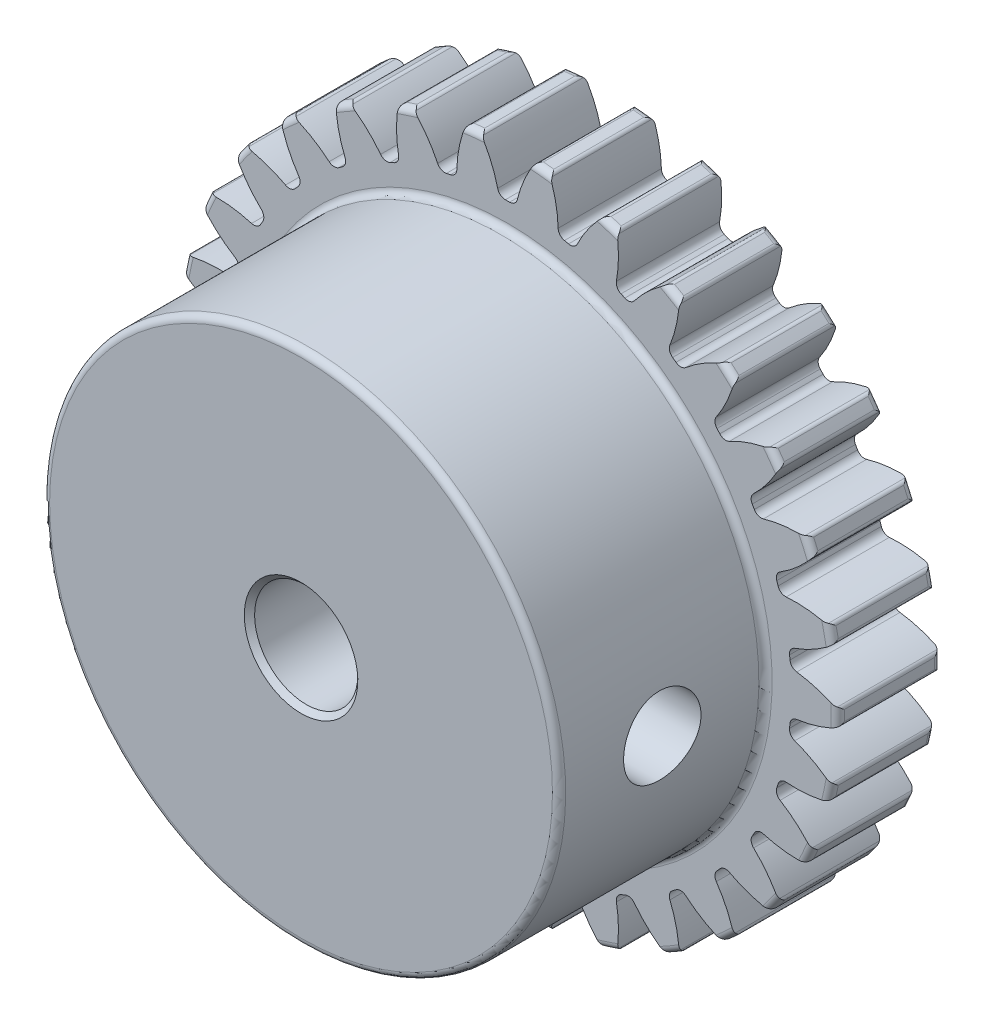
from build123d import *

# Parameters (mm, degrees)
FILLET2_R                = 0.256
CUT_EXTRUDE2_DEPTH       = 20.790907108
FILLET3_R                = 0.304000006
FILLET4_R                = 0.152000003
CIRPATTERN1_COUNT        = 30
FILLET3_OF_CIRPATTERN1_R = 0.304000006
FILLET4_OF_CIRPATTERN1_R = 0.152000003
CUT_EXTRUDE3_REACH       = 30.747
CUT_EXTRUDE3_END_RADIUS  = 2
SKETCH8_R                = 1.5
CHAMFER1_SIZE            = 0.2


with BuildPart() as part:
    # Sketch4 → Revolve1 (revolve)
    with BuildSketch(Plane(origin=(0, 0, 0), x_dir=(0, 0, -1), z_dir=(1, 0, 0))):
        Polygon((-12, 2), (-12, 10), (-4, 10), (-4, 12.8), (0, 12.8), (0, 2), align=None)
    revolve(axis=Axis((0, 0, 4), (0, 0, 1)))

    # Fillet2
    fillet2_edges = [part.edges().sort_by_distance(p)[0] for p in [
        (0, -12.8, 0),
        (0, -12.8, 4),
        (0, -10, 4),
        (0, -10, 12),
    ]]
    fillet(fillet2_edges, radius=FILLET2_R)

    # Sketch7 → Cut-Extrude2 (cut, through all)
    with BuildSketch(Plane.XY.offset(4)):
        with BuildLine():
            ThreePointArc((-1.043819173, 12.757368127), (0, 12.8), (1.043819173, 12.757368127))
            ThreePointArc((1.043819173, 12.757368127), (0.598324806, 11.911969775), (0.329126879, 10.995074972))
            ThreePointArc((0.329126879, 10.995074972), (0, 10.999999916), (-0.329126879, 10.995074972))
            ThreePointArc((-0.329126879, 10.995074972), (-0.598324806, 11.911969775), (-1.043819173, 12.757368127))
        make_face()
    cut_extrude2 = extrude(amount=-CUT_EXTRUDE2_DEPTH, mode=Mode.SUBTRACT)

    # Fillet3
    fillet3_edges = [part.edges().sort_by_distance(p)[0] for p in [
        (-0.329126879, 10.995074972, 2),
        (0.329126879, 10.995074972, 2),
    ]]
    fillet(fillet3_edges, radius=FILLET3_R)

    # Fillet4
    # the kernel refuses this fillet: 0.152000003 mm, written as the material it takes off along each edge
    with BuildSketch(Plane(origin=(1.043819173, 12.757368127, 3.97571258), x_dir=(-0.5438656708728365, -0.8391722898463934, 0), z_dir=(0, 0, -1))) as fillet4_piece_1:
        with BuildLine():
            CenterArc((0.091217519, -0.151992919), FILLET4_R, 89.446818368, 62.694276577)
            ThreePointArc((-0.043165839, -0.080963953), (-0.021655465, -0.040443299), (0, 0))
            ThreePointArc((0, 0), (0.046342516, 0.000223717), (0.092685032, 0))
        make_face()
    extrude(amount=3.95142516, mode=Mode.SUBTRACT)
    with BuildSketch(Plane(origin=(-1.043819173, 12.757368127, 3.97571258), x_dir=(0.5438656708728365, -0.8391722898463934, 0), z_dir=(0, 0, -1))) as fillet4_piece_2:
        with BuildLine():
            CenterArc((0.091217519, 0.151992919), FILLET4_R, 207.858905055, 62.694276577)
            ThreePointArc((-0.043165839, 0.080963953), (-0.021655465, 0.040443299), (0, 0))
            ThreePointArc((0, 0), (0.046342516, -0.000223717), (0.092685032, 0))
        make_face()
    extrude(amount=3.95142516, mode=Mode.SUBTRACT)

    # CirPattern1: Cut-Extrude2 ×30 about axis
    cirpattern1_axis = Axis((0, 0, 0), (0, 0, 1))
    for i in range(1, CIRPATTERN1_COUNT):
        add(cut_extrude2.rotate(cirpattern1_axis, i * 360 / CIRPATTERN1_COUNT), mode=Mode.SUBTRACT)

    # Fillet3 of CirPattern1
    fillet3_of_cirpattern1_edges = [part.edges().sort_by_distance(p)[0] for p in [
        (-2.607939295, 10.686376878, 2),
        (-1.964069961, 10.82323553, 2),
        (-4.77277225, 9.910632835, 2),
        (-4.171427519, 10.178368759, 2),
        (-6.729012155, 8.701746581, 2),
        (-6.196473678, 9.088658433, 2),
        (-8.391161939, 7.112552246, 2),
        (-7.950704203, 7.60173012, 2),
        (-9.686577682, 5.212505248, 2),
        (-9.357450803, 5.782569724, 2),
        (-10.558643498, 3.084646758, 2),
        (-10.3552319, 3.710683284, 2),
        (-10.969245928, 0.821974403, 2),
        (-10.900439674, 1.476622178, 2),
        (-10.900439674, -1.476622178, 2),
        (-10.969245928, -0.821974403, 2),
        (-10.3552319, -3.710683284, 2),
        (-10.558643498, -3.084646758, 2),
        (-9.357450803, -5.782569724, 2),
        (-9.686577682, -5.212505248, 2),
        (-7.950704203, -7.60173012, 2),
        (-8.391161939, -7.112552246, 2),
        (-6.196473678, -9.088658433, 2),
        (-6.729012155, -8.701746581, 2),
        (-4.171427519, -10.178368759, 2),
        (-4.77277225, -9.910632835, 2),
        (-1.964069961, -10.82323553, 2),
        (-2.607939295, -10.686376878, 2),
        (0.329126879, -10.995074972, 2),
        (-0.329126879, -10.995074972, 2),
        (2.607939295, -10.686376878, 2),
        (1.964069961, -10.82323553, 2),
        (4.77277225, -9.910632835, 2),
        (4.171427519, -10.178368759, 2),
        (6.729012155, -8.701746581, 2),
        (6.196473678, -9.088658433, 2),
        (8.391161939, -7.112552246, 2),
        (7.950704203, -7.60173012, 2),
        (9.686577682, -5.212505248, 2),
        (9.357450803, -5.782569724, 2),
        (10.558643498, -3.084646758, 2),
        (10.3552319, -3.710683284, 2),
        (10.969245928, -0.821974403, 2),
        (10.900439674, -1.476622178, 2),
        (10.900439674, 1.476622178, 2),
        (10.969245928, 0.821974403, 2),
        (10.3552319, 3.710683284, 2),
        (10.558643498, 3.084646758, 2),
        (9.357450803, 5.782569724, 2),
        (9.686577682, 5.212505248, 2),
        (7.950704203, 7.60173012, 2),
        (8.391161939, 7.112552246, 2),
        (6.196473678, 9.088658433, 2),
        (6.729012155, 8.701746581, 2),
        (4.171427519, 10.178368759, 2),
        (4.77277225, 9.910632835, 2),
        (1.964069961, 10.82323553, 2),
        (2.607939295, 10.686376878, 2),
    ]]
    fillet(fillet3_of_cirpattern1_edges, radius=FILLET3_OF_CIRPATTERN1_R)

    # Fillet4 of CirPattern1
    # the kernel refuses this fillet: 0.152000003 mm, written as the material it takes off along each edge
    with BuildSketch(Plane(origin=(-1.631396758, 12.695611235, 3.97571258), x_dir=(-0.35750717141636573, -0.9339103931244525, 0), z_dir=(0, 0, -1)), Plane(origin=(-4.235312822, 12.078995211, 3.97571258), x_dir=(-0.15552389305926648, -0.987832130823699, 0), z_dir=(0, 0, -1)), Plane(origin=(-6.654125393, 10.934469135, 3.97571258), x_dir=(0.053256525710956806, -0.9985808642614769, 0), z_dir=(0, 0, -1)), Plane(origin=(-8.782120754, 9.312054288, 3.97571258), x_dir=(0.2597093787544534, -0.9656868222084093, 0), z_dir=(0, 0, -1)), Plane(origin=(-10.526295297, 7.282657985, 3.97571258), x_dir=(0.45481168572251524, -0.8905876321453402, 0), z_dir=(0, 0, -1)), Plane(origin=(-11.810420225, 4.934974582, 3.97571258), x_dir=(0.6300365395958905, -0.7765654890439285, 0), z_dir=(0, 0, -1)), Plane(origin=(-12.578373116, 2.371609108, 3.97571258), x_dir=(0.7777257734382018, -0.6286037076966305, 0), z_dir=(0, 0, -1)), Plane(origin=(-12.796590744, -0.295407063, 3.97571258), x_dir=(0.8914246590389396, -0.45316892794774694, 0), z_dir=(0, 0, -1)), Plane(origin=(-12.455535952, -2.949512528, 3.97571258), x_dir=(0.9661640095095748, -0.2579284915017773, 0), z_dir=(0, 0, -1)), Plane(origin=(-11.57011447, -5.474710142, 3.97571258), x_dir=(0.9986773565953533, -0.05141534229894341, 0), z_dir=(0, 0, -1)), Plane(origin=(-10.179023467, -7.760636653, 3.97571258), x_dir=(0.9875437110122719, 0.15734490408052806, 0), z_dir=(0, 0, -1)), Plane(origin=(-8.343060294, -9.707386102, 3.97571258), x_dir=(0.9332496664974688, 0.3592284231270728, 0), z_dir=(0, 0, -1)), Plane(origin=(-6.142465351, -11.229876197, 3.97571258), x_dir=(0.8381681333279807, 0.5454119363137264, 0), z_dir=(0, 0, -1)), Plane(origin=(-3.673415198, -12.261566816, 3.97571258), x_dir=(0.7064546307551236, 0.7077583307066346, 0), z_dir=(0, 0, -1)), Plane(origin=(-1.043819173, -12.757368127, 3.97571258), x_dir=(0.5438656708728248, 0.839172289846401, 0), z_dir=(0, 0, -1)), Plane(origin=(1.631396758, -12.695611235, 3.97571258), x_dir=(0.3575071714163638, 0.9339103931244532, 0), z_dir=(0, 0, -1)), Plane(origin=(4.235312822, -12.078995211, 3.97571258), x_dir=(0.1555238930592729, 0.9878321308236981, 0), z_dir=(0, 0, -1)), Plane(origin=(6.654125393, -10.934469135, 3.97571258), x_dir=(-0.05325652571095579, 0.998580864261477, 0), z_dir=(0, 0, -1)), Plane(origin=(8.782120754, -9.312054288, 3.97571258), x_dir=(-0.2597093787544486, 0.9656868222084106, 0), z_dir=(0, 0, -1)), Plane(origin=(10.526295297, -7.282657985, 3.97571258), x_dir=(-0.45481168572250785, 0.8905876321453442, 0), z_dir=(0, 0, -1)), Plane(origin=(11.810420225, -4.934974582, 3.97571258), x_dir=(-0.6300365395959046, 0.7765654890439171, 0), z_dir=(0, 0, -1)), Plane(origin=(12.578373116, -2.371609108, 3.97571258), x_dir=(-0.7777257734381986, 0.6286037076966342, 0), z_dir=(0, 0, -1)), Plane(origin=(12.796590744, 0.295407063, 3.97571258), x_dir=(-0.89142465903894, 0.4531689279477463, 0), z_dir=(0, 0, -1)), Plane(origin=(12.455535952, 2.949512528, 3.97571258), x_dir=(-0.9661640095095796, 0.25792849150175945, 0), z_dir=(0, 0, -1)), Plane(origin=(11.57011447, 5.474710142, 3.97571258), x_dir=(-0.9986773565953533, 0.05141534229894242, 0), z_dir=(0, 0, -1)), Plane(origin=(10.179023467, 7.760636653, 3.97571258), x_dir=(-0.9875437110122719, -0.15734490408052806, 0), z_dir=(0, 0, -1)), Plane(origin=(8.343060294, 9.707386102, 3.97571258), x_dir=(-0.9332496664974751, -0.3592284231270561, 0), z_dir=(0, 0, -1)), Plane(origin=(6.142465351, 11.229876197, 3.97571258), x_dir=(-0.8381681333279718, -0.5454119363137403, 0), z_dir=(0, 0, -1)), Plane(origin=(3.673415198, 12.261566816, 3.97571258), x_dir=(-0.7064546307551236, -0.7077583307066346, 0), z_dir=(0, 0, -1))) as fillet4_of_cirpattern1_piece_1:
        with BuildLine():
            CenterArc((0.091217519, -0.151992919), FILLET4_OF_CIRPATTERN1_R, 89.446818368, 62.694276577)
            ThreePointArc((-0.043165839, -0.080963953), (-0.021655465, -0.040443299), (0, 0))
            ThreePointArc((0, 0), (0.046342516, 0.000223717), (0.092685032, 0))
        make_face()
    extrude(amount=3.95142516, mode=Mode.SUBTRACT)
    with BuildSketch(Plane(origin=(-3.673415198, 12.261566816, 3.97571258), x_dir=(0.7064546307551188, -0.7077583307066394, 0), z_dir=(0, 0, -1)), Plane(origin=(-6.142465351, 11.229876197, 3.97571258), x_dir=(0.8381681333279779, -0.5454119363137309, 0), z_dir=(0, 0, -1)), Plane(origin=(-8.343060294, 9.707386102, 3.97571258), x_dir=(0.9332496664974712, -0.35922842312706643, 0), z_dir=(0, 0, -1)), Plane(origin=(-10.179023467, 7.760636653, 3.97571258), x_dir=(0.9875437110122709, -0.157344904080534, 0), z_dir=(0, 0, -1)), Plane(origin=(-11.57011447, 5.474710142, 3.97571258), x_dir=(0.9986773565953535, 0.051415342298941444, 0), z_dir=(0, 0, -1)), Plane(origin=(-12.455535952, 2.949512528, 3.97571258), x_dir=(0.9661640095095783, 0.25792849150176356, 0), z_dir=(0, 0, -1)), Plane(origin=(-12.796590744, 0.295407063, 3.97571258), x_dir=(0.8914246590389477, 0.4531689279477311, 0), z_dir=(0, 0, -1)), Plane(origin=(-12.578373116, -2.371609108, 3.97571258), x_dir=(0.7777257734382, 0.6286037076966328, 0), z_dir=(0, 0, -1)), Plane(origin=(-11.810420225, -4.934974582, 3.97571258), x_dir=(0.6300365395959067, 0.7765654890439153, 0), z_dir=(0, 0, -1)), Plane(origin=(-10.526295297, -7.282657985, 3.97571258), x_dir=(0.4548116857225192, 0.8905876321453384, 0), z_dir=(0, 0, -1)), Plane(origin=(-8.782120754, -9.312054288, 3.97571258), x_dir=(0.25970937875446165, 0.9656868222084071, 0), z_dir=(0, 0, -1)), Plane(origin=(-6.654125393, -10.934469135, 3.97571258), x_dir=(0.053256525710956806, 0.9985808642614769, 0), z_dir=(0, 0, -1)), Plane(origin=(-4.235312822, -12.078995211, 3.97571258), x_dir=(-0.15552389305927583, 0.9878321308236976, 0), z_dir=(0, 0, -1)), Plane(origin=(-1.631396758, -12.695611235, 3.97571258), x_dir=(-0.35750717141637406, 0.9339103931244492, 0), z_dir=(0, 0, -1)), Plane(origin=(1.043819173, -12.757368127, 3.97571258), x_dir=(-0.5438656708728327, 0.839172289846396, 0), z_dir=(0, 0, -1)), Plane(origin=(3.673415198, -12.261566816, 3.97571258), x_dir=(-0.7064546307551236, 0.7077583307066346, 0), z_dir=(0, 0, -1)), Plane(origin=(6.142465351, -11.229876197, 3.97571258), x_dir=(-0.838168133327969, 0.5454119363137443, 0), z_dir=(0, 0, -1)), Plane(origin=(8.343060294, -9.707386102, 3.97571258), x_dir=(-0.9332496664974688, 0.3592284231270728, 0), z_dir=(0, 0, -1)), Plane(origin=(10.179023467, -7.760636653, 3.97571258), x_dir=(-0.9875437110122709, 0.157344904080534, 0), z_dir=(0, 0, -1)), Plane(origin=(11.57011447, -5.474710142, 3.97571258), x_dir=(-0.9986773565953535, -0.051415342298941444, 0), z_dir=(0, 0, -1)), Plane(origin=(12.455535952, -2.949512528, 3.97571258), x_dir=(-0.966164009509577, -0.2579284915017684, 0), z_dir=(0, 0, -1)), Plane(origin=(12.796590744, -0.295407063, 3.97571258), x_dir=(-0.8914246590389363, -0.4531689279477536, 0), z_dir=(0, 0, -1)), Plane(origin=(12.578373116, 2.371609108, 3.97571258), x_dir=(-0.7777257734382024, -0.6286037076966299, 0), z_dir=(0, 0, -1)), Plane(origin=(11.810420225, 4.934974582, 3.97571258), x_dir=(-0.6300365395959092, -0.7765654890439133, 0), z_dir=(0, 0, -1)), Plane(origin=(10.526295297, 7.282657985, 3.97571258), x_dir=(-0.4548116857225001, -0.8905876321453481, 0), z_dir=(0, 0, -1)), Plane(origin=(8.782120754, 9.312054288, 3.97571258), x_dir=(-0.2597093787544582, -0.965686822208408, 0), z_dir=(0, 0, -1)), Plane(origin=(6.654125393, 10.934469135, 3.97571258), x_dir=(-0.05325652571095579, -0.998580864261477, 0), z_dir=(0, 0, -1)), Plane(origin=(4.235312822, 12.078995211, 3.97571258), x_dir=(0.15552389305925127, -0.9878321308237016, 0), z_dir=(0, 0, -1)), Plane(origin=(1.631396758, 12.695611235, 3.97571258), x_dir=(0.3575071714163721, -0.93391039312445, 0), z_dir=(0, 0, -1))) as fillet4_of_cirpattern1_piece_2:
        with BuildLine():
            CenterArc((0.091217519, 0.151992919), FILLET4_OF_CIRPATTERN1_R, 207.858905055, 62.694276577)
            ThreePointArc((-0.043165839, 0.080963953), (-0.021655465, 0.040443299), (0, 0))
            ThreePointArc((0, 0), (0.046342516, -0.000223717), (0.092685032, 0))
        make_face()
    extrude(amount=3.95142516, mode=Mode.SUBTRACT)

    # Cut-Extrude3: up to this cylinder (the profile starts outside it)
    cut_extrude3_end = Plane(origin=(0, 0, 8), z_dir=(0, 0, -1)) * Cylinder(CUT_EXTRUDE3_END_RADIUS, 66.494, mode=Mode.PRIVATE)
    # Sketch8 → Cut-Extrude3 (cut, up to the surface)
    with BuildSketch(Plane(origin=(10, 0, 0), x_dir=(0, 0, -1), z_dir=(1, 0, 0)), mode=Mode.PRIVATE) as cut_extrude3_sk1:
        with Locations((-8, 0)):
            Circle(SKETCH8_R)
    cut_extrude3_tool1 = extrude(cut_extrude3_sk1.sketch, amount=-CUT_EXTRUDE3_REACH, mode=Mode.PRIVATE) - cut_extrude3_end
    add(cut_extrude3_tool1.solids().sort_by_distance((10, 0, 8))[0], mode=Mode.SUBTRACT)

    # Chamfer1
    chamfer1_edges = [part.edges().sort_by_distance(p)[0] for p in [
        (0, -2, 0),
        (0, -2, 12),
    ]]
    chamfer(chamfer1_edges, length=CHAMFER1_SIZE)


solid = part.part
